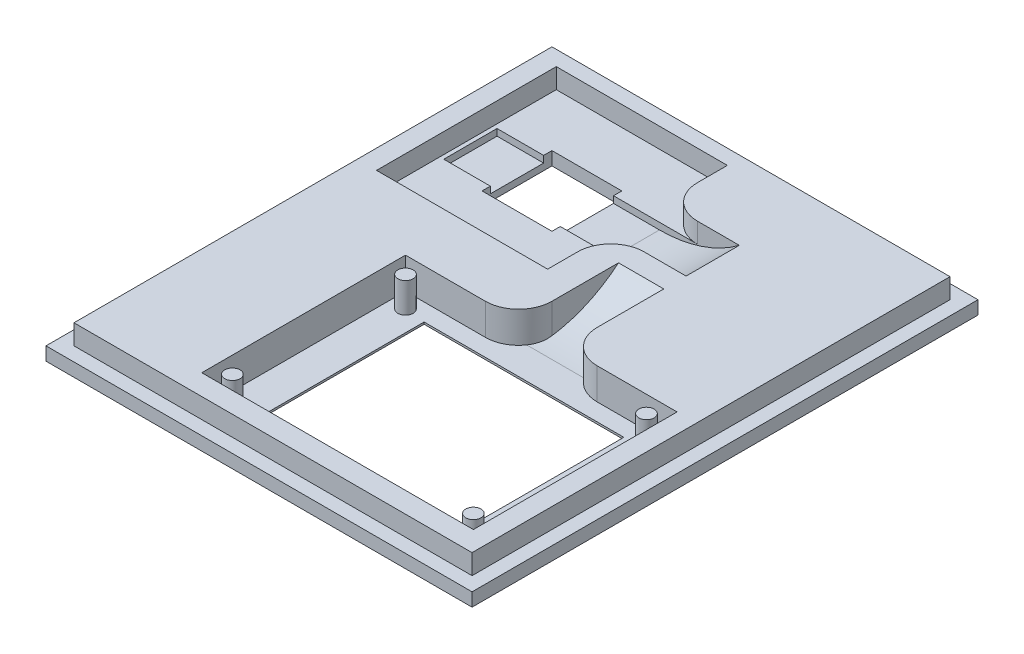
from build123d import *

# Parameters (mm, degrees)
SKETCH1_W           = 64
SKETCH1_H           = 76
TOP_DEPTH           = 2
SKETCH2_W           = 59.8
SKETCH2_H           = 71.8
BOSS_EXTRUDE2_DEPTH = 3
SKETCH3_W           = 10.5
SKETCH3_H           = 10.5
CUT_EXTRUDE1_DEPTH  = 6
SKETCH10_W          = 25.7
SKETCH10_H          = 27
CUT_EXTRUDE8_DEPTH  = 3
SKETCH11_W          = 7
SKETCH11_H          = 8
CUT_EXTRUDE9_DEPTH  = 1
SKETCH6_W           = 30
SKETCH6_H           = 25.4
CUT_EXTRUDE4_DEPTH  = 6
SKETCH7_R           = 1.15
BOSS_EXTRUDE3_DEPTH = 4.7
SKETCH8_W           = 40.8
SKETCH8_H           = 30.6
CUT_EXTRUDE6_DEPTH  = 4.7
SKETCH9_W           = 6.8
SKETCH9_H           = 15
CUT_EXTRUDE7_DEPTH  = 4.7
FILLET2_R           = 20
FILLET3_START       = 0.3
FILLET3_DEPTH       = 5.7
FILLET3_START_2     = 1
FILLET3_2_DEPTH     = 11
SKETCH14_R          = 1.15
BOSS_EXTRUDE4_DEPTH = 4.5
SKETCH12_W          = 11.9
SKETCH12_H          = 8
CUT_EXTRUDE10_DEPTH = 4
FILLET4_R           = 20
FILLET5_R           = 5


with BuildPart() as part:
    # Sketch1 → Top (new body)
    with BuildSketch(Plane(origin=(0, 0, 0), x_dir=(1, 0, 0), z_dir=(0, 1, 0))):
        Rectangle(SKETCH1_W, SKETCH1_H)
    extrude(amount=TOP_DEPTH)

    # Sketch2 → Boss-Extrude2 (add)
    with BuildSketch(Plane(origin=(0, 2, 0), x_dir=(1, 0, 0), z_dir=(0, 1, 0))):
        Rectangle(SKETCH2_W, SKETCH2_H)
    extrude(amount=BOSS_EXTRUDE2_DEPTH)

    # Sketch3 → Cut-Extrude1 (cut)
    with BuildSketch(Plane(origin=(0, 5, 0), x_dir=(1, 0, 0), z_dir=(0, 1, 0))):
        with Locations((-14.15, 20.15)):
            Rectangle(SKETCH3_W, SKETCH3_H)
    extrude(amount=-CUT_EXTRUDE1_DEPTH, mode=Mode.SUBTRACT)

    # Sketch10 → Cut-Extrude8 (cut)
    with BuildSketch(Plane(origin=(0, 5, 0), x_dir=(1, 0, 0), z_dir=(0, 1, 0))):
        with Locations((-14.15, 20.15)):
            Rectangle(SKETCH10_W, SKETCH10_H)
    extrude(amount=-CUT_EXTRUDE8_DEPTH, mode=Mode.SUBTRACT)

    # Sketch11 → Cut-Extrude9 (cut)
    with BuildSketch(Plane(origin=(0, 2, 0), x_dir=(1, 0, 0), z_dir=(0, 1, 0))):
        with Locations((-22.9, 20.15)):
            Rectangle(SKETCH11_W, SKETCH11_H)
        with Locations((-5.4, 20.15)):
            Rectangle(SKETCH11_W, SKETCH11_H)
    extrude(amount=-CUT_EXTRUDE9_DEPTH, mode=Mode.SUBTRACT)

    # Sketch6 → Cut-Extrude4 (cut)
    with BuildSketch(Plane(origin=(0, 5, 0), x_dir=(1, 0, 0), z_dir=(0, 1, 0))):
        with Locations((6.6, -17.5)):
            Rectangle(SKETCH6_W, SKETCH6_H)
    extrude(amount=-CUT_EXTRUDE4_DEPTH, mode=Mode.SUBTRACT)

    # Sketch7 → Boss-Extrude3 (add)
    with BuildSketch(Plane(origin=(0, 5, 0), x_dir=(1, 0, 0), z_dir=(0, 1, 0))):
        with Locations((-11.5, -4.5)):
            Circle(SKETCH7_R)
        with Locations((-11.5, -30.5)):
            Circle(SKETCH7_R)
        with Locations((24.7, -30.5)):
            Circle(SKETCH7_R)
        with Locations((24.7, -4.5)):
            Circle(SKETCH7_R)
    extrude(amount=-BOSS_EXTRUDE3_DEPTH)

    # Sketch8 → Cut-Extrude6 (cut)
    with BuildSketch(Plane(origin=(0, 5, 0), x_dir=(1, 0, 0), z_dir=(0, 1, 0))):
        with Locations((6.6, -17.5)):
            Rectangle(SKETCH8_W, SKETCH8_H)
    extrude(amount=-CUT_EXTRUDE6_DEPTH, mode=Mode.SUBTRACT)

    # Sketch9 → Cut-Extrude7 (cut)
    with BuildSketch(Plane(origin=(0, 5, 0), x_dir=(1, 0, 0), z_dir=(0, 1, 0))):
        with Locations((6.6, 5.3)):
            Rectangle(SKETCH9_W, SKETCH9_H)
    extrude(amount=-CUT_EXTRUDE7_DEPTH, mode=Mode.SUBTRACT)

    # Fillet2
    # the kernel refuses this fillet: 20 mm, written as the material it adds along each edge
    with BuildSketch(Plane(origin=(3.2, 0.3, -12.8), x_dir=(0, 0, 1), z_dir=(1, 0, 0))) as fillet2_piece_1:
        with BuildLine():
            CenterArc((12.880605576, -20), FILLET2_R, 90, 40.093007985)
            Line((0, -4.7), (0, 0))
            Line((0, 0), (12.880605576, 0))
        make_face()
    extrude(amount=6.8)

    # Fillet3: read off the stored shape, not the designer's step
    # Fillet3 outline → Fillet3 (cut)
    with BuildSketch(Plane(origin=(0, 0, 0), x_dir=(1, 0, 0), z_dir=(0, 1, 0)).offset(FILLET3_START)):
        with BuildLine():
            ThreePointArc((15, -2.2), (11.464466094, -0.735533906), (10, 2.8))
            Line((10, 2.8), (10, -2.2))
            Line((10, -2.2), (15, -2.2))
        make_face()
        with BuildLine():
            ThreePointArc((3.2, 2.8), (1.735533906, -0.735533906), (-1.8, -2.2))
            Line((-1.8, -2.2), (3.2, -2.2))
            Line((3.2, -2.2), (3.2, 2.8))
        make_face()
    extrude(amount=FILLET3_DEPTH, mode=Mode.SUBTRACT)

    # Fillet3 2 outline → Fillet3 2 (add)
    with BuildSketch(Plane.YZ.offset(FILLET3_START_2)):
        with BuildLine():
            Line((0.3, 0.080605576), (0.3, -2.8))
            Line((0.3, -2.8), (0.508534377, -2.8))
            ThreePointArc((0.508534377, -2.8), (0.35220172, -1.363466364), (0.3, 0.080605576))
        make_face()
    extrude(amount=FILLET3_2_DEPTH)

    # Sketch14 → Boss-Extrude4 (add)
    with BuildSketch(Plane(origin=(0, 0.3, 0), x_dir=(1, 0, 0), z_dir=(0, 1, 0))):
        with Locations(Location((-11.5, -4.5, 0), (0, 0, 270))):
            Circle(SKETCH14_R)
        with Locations(Location((24.7, -4.5, 0), (0, 0, 90))):
            Circle(SKETCH14_R)
        with Locations(Location((24.7, -30.5, 0), (0, 0, 270))):
            Circle(SKETCH14_R)
        with Locations(Location((-11.5, -30.5, 0), (0, 0, 90))):
            Circle(SKETCH14_R)
    extrude(amount=BOSS_EXTRUDE4_DEPTH)

    # Sketch12 → Cut-Extrude10 (cut)
    with BuildSketch(Plane(origin=(0, 5, 0), x_dir=(1, 0, 0), z_dir=(0, 1, 0))):
        with Locations((4.05, 20.15)):
            Rectangle(SKETCH12_W, SKETCH12_H)
    extrude(amount=-CUT_EXTRUDE10_DEPTH, mode=Mode.SUBTRACT)

    # Fillet4
    # the kernel refuses this fillet: 20 mm, written as the material it adds along each edge
    with BuildSketch(Plane(origin=(10, 1, -54.15), x_dir=(-1, 0, 0), z_dir=(0, 0, 1))) as fillet4_piece_1_section:
        with BuildLine():
            CenterArc((12, -20), FILLET4_R, 90, 36.869897646)
            Line((0, -4), (0, 0))
            Line((0, 0), (12, 0))
        make_face()
    fillet4_piece_1 = extrude(amount=38, mode=Mode.PRIVATE)
    fillet4_piece_1 = split(fillet4_piece_1, bisect_by=Plane(origin=(10, 1, -35.9), z_dir=(0, 0, 1)), keep=Keep.TOP, mode=Mode.PRIVATE)
    add(fillet4_piece_1)

    # Fillet5
    fillet5_edges = [part.edges().sort_by_distance(p)[0] for p in [
        (-1.3, 3.5, -24.15),
        (-1.3, 3.5, -16.15),
    ]]
    fillet(fillet5_edges, radius=FILLET5_R)


solid = part.part
